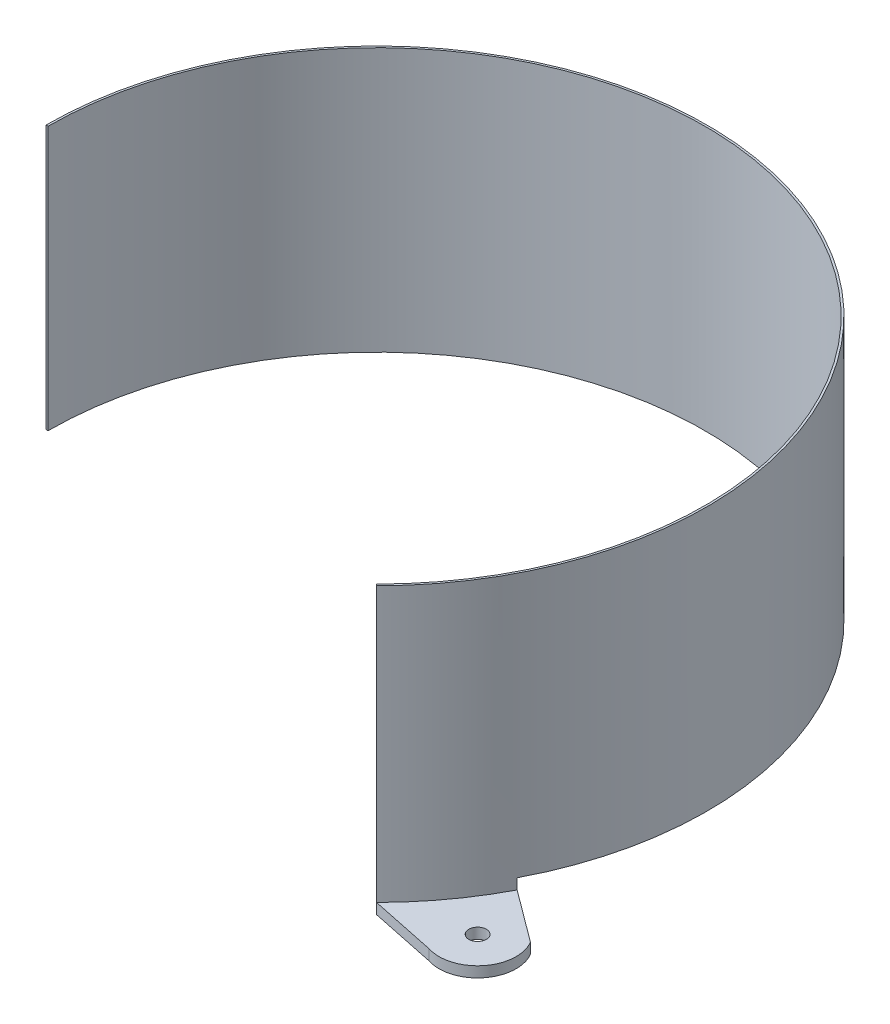
from build123d import *

# Parameters (mm, degrees)
BASE_FLANGE1_DEPTH  = 102.87
CUT_EXTRUDE1_START  = -7.62
CUT_EXTRUDE1_DEPTH  = 7.62
SKETCH8_R           = 3.175
BOSS_EXTRUDE1_DEPTH = 3.81


# Read off the part's stored shape, not the designer's step: Cut-Extrude1
# Sheet-metal steps are written as plain solids
with BuildPart() as part:
    # Sketch2 → Base-Flange1 (new body)
    with BuildSketch(Plane(origin=(0, 0, 0), x_dir=(1, 0, 0), z_dir=(0, 1, 0))):
        with BuildLine():
            ThreePointArc((-119.38, 0), (45.684748156, 110.292738591), (84.414407538, -84.414407538))
            Line((84.414407538, -84.414407538), (83.893552683, -83.893552683))
            ThreePointArc((83.893552683, -83.893552683), (45.402863539, 109.612208928), (-118.6434, 0))
            Line((-118.6434, 0), (-119.38, 0))
        make_face()
    extrude(amount=BASE_FLANGE1_DEPTH)

    # Cut-Extrude1 outline → Cut-Extrude1 (cut)
    with BuildSketch(Plane.XZ.offset(CUT_EXTRUDE1_START)):
        with BuildLine():
            ThreePointArc((-119.38, 0), (28.374941826, -115.958816294), (105.891353265, 55.123549448))
            Line((105.891353265, 55.123549448), (105.237981085, 54.783425419))
            ThreePointArc((105.237981085, 54.783425419), (28.199862397, -115.243325726), (-118.6434, 0))
            Line((-118.6434, 0), (-119.38, 0))
        make_face()
    extrude(amount=CUT_EXTRUDE1_DEPTH, mode=Mode.SUBTRACT)

    # Sketch8 → Boss-Extrude1 (add)
    with BuildSketch(Plane.XZ):
        with BuildLine():
            Line((105.891353265, 55.123549448), (124.635571409, 69.054164544))
            ThreePointArc((124.635571409, 69.054164544), (123.499250093, 84.844358217), (108.336377108, 89.39504225))
            Line((108.336377108, 89.39504225), (84.414407538, 84.414407538))
            ThreePointArc((84.414407538, 84.414407538), (96.273356857, 70.590545822), (105.891353265, 55.123549448))
        make_face()
        with Locations(Location((112.618181959, 76.125332112, 0), (0, 0, 270))):
            Circle(SKETCH8_R, mode=Mode.SUBTRACT)
    extrude(amount=-BOSS_EXTRUDE1_DEPTH)


solid = part.part
